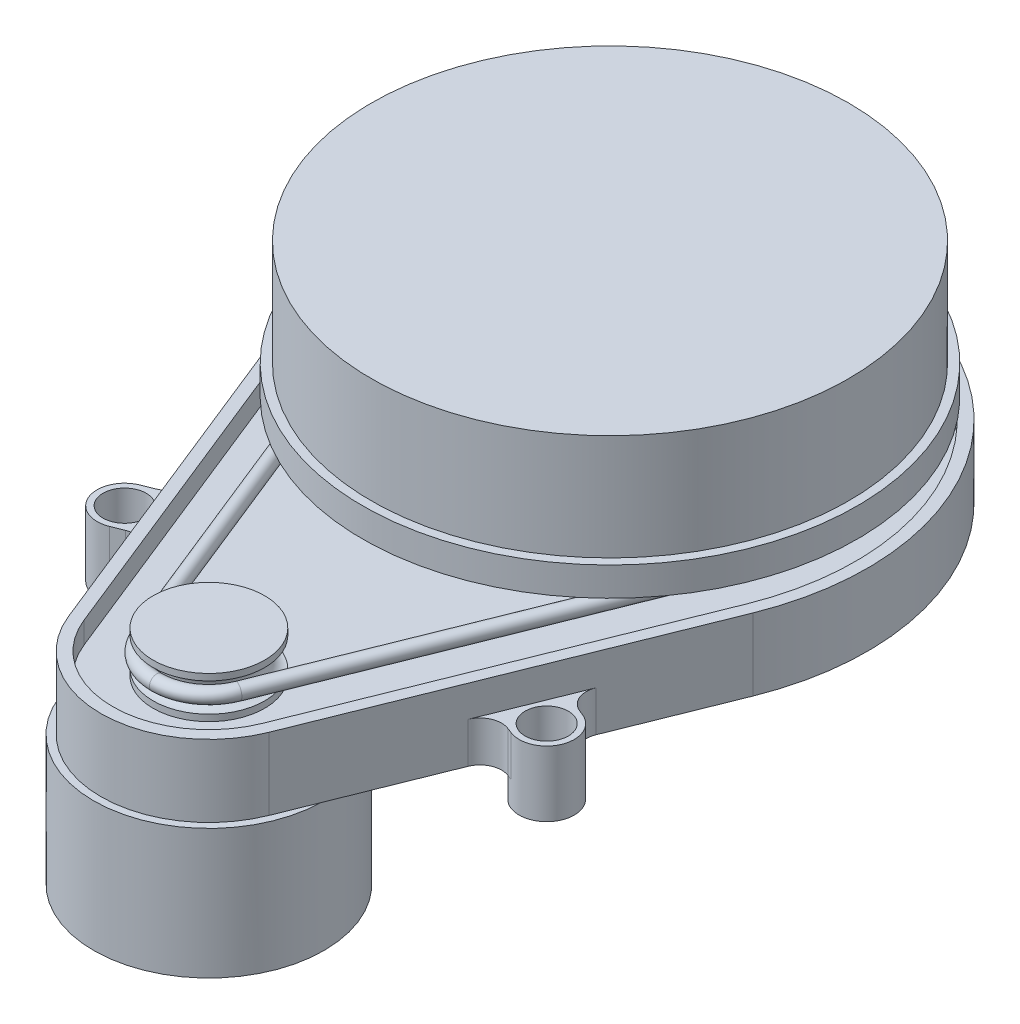
from build123d import *

# Parameters (mm, degrees)
EXTRUDE_1_DEPTH     = 10
CUT_EXTRUDE_1_DEPTH = 3
SKETCH_4_R          = 7.75
EXTRUDE_2_DEPTH     = 5.8
SKETCH_8_R          = 1
EXTRUDE_3_DEPTH     = 5.65
EXTRUDE_START       = 3.45
SKETCH_10_R         = 3.825
EXTRUDE_4_DEPTH     = 3.45
SKETCH_11_R         = 3
CUT_EXTRUDE_2_DEPTH = 4.85
SKETCH_12_R         = 1.7
CUT_EXTRUDE_3_DEPTH = 85.964948655
CUT_EXTRUDE_START   = -2
SKETCH_13_R         = 3
CUT_EXTRUDE_4_DEPTH = 2
SKETCH_14_R         = 16
EXTRUDE_5_DEPTH     = 18
SKETCH_15_R         = 3.75
EXTRUDE_6_DEPTH     = 3
SKETCH_16_R         = 5.25
CUT_EXTRUDE_5_DEPTH = 87.088341255
FILLET_1_R          = 3


with BuildPart() as part:
    # 草圖2 → 填料-伸長1 (new body)
    with BuildSketch(Plane(origin=(0, 0, 0), x_dir=(1, 0, 0), z_dir=(0, 1, 0))):
        with BuildLine():
            Line((-33.176700014, -13.317998205), (-13.920293712, -61.287971275))
            ThreePointArc((-13.920293712, -61.287971275), (0, -70.7), (13.920293712, -61.287971275))
            Line((13.920293712, -61.287971275), (33.176700014, -13.317998205))
            ThreePointArc((33.176700014, -13.317998205), (0, 35.75), (-33.176700014, -13.317998205))
        make_face()
    extrude(amount=EXTRUDE_1_DEPTH)

    # 草圖3 → 除料-伸長1 (cut)
    with BuildSketch(Plane(origin=(0, 10, 0), x_dir=(1, 0, 0), z_dir=(0, 1, 0))):
        with BuildLine():
            ThreePointArc((-12.389061404, -60.673294434), (0, -69.05), (12.389061404, -60.673294434))
            Line((12.389061404, -60.673294434), (31.645467706, -12.703321364))
            ThreePointArc((31.645467706, -12.703321364), (0, 34.1), (-31.645467706, -12.703321364))
            Line((-31.645467706, -12.703321364), (-12.389061404, -60.673294434))
        make_face()
    extrude(amount=-CUT_EXTRUDE_1_DEPTH, mode=Mode.SUBTRACT)

    # 草圖4 → 填料-伸長2 (add)
    with BuildSketch(Plane(origin=(0, 7, 0), x_dir=(1, 0, 0), z_dir=(0, 1, 0))):
        with Locations((0, -55.7)):
            Circle(SKETCH_4_R)
    extrude(amount=EXTRUDE_2_DEPTH)

    # 草圖5 → 除料-旋轉1 (revolve, cut)
    with BuildSketch(Plane(origin=(0, 0, 0), x_dir=(0, 0, -1), z_dir=(1, 0, 0))):
        with BuildLine():
            Line((-47.95, 11.9), (-47.95, 7.9))
            ThreePointArc((-47.95, 7.9), (-49.95, 9.9), (-47.95, 11.9))
        make_face()
    revolve(axis=Axis((0, 12.8, 55.7), (0, -1, 0)), mode=Mode.SUBTRACT)

    # 草圖6 → 旋轉1 (revolve)
    with BuildSketch(Plane(origin=(0, 0, 0), x_dir=(0, 0, -1), z_dir=(1, 0, 0))):
        Polygon((10, 12.8), (34.35, 12.8), (34.35, 16.8), (33.15, 16.8), (33.15, 31.5), (0, 31.5), (0, 7), (10, 7), align=None)
    revolve(axis=Axis((0, 7, 0), (0, 1, 0)))

    # 草圖9 → 填料-伸長3 (add)
    with BuildSketch(Plane(origin=(0, 0, 0), x_dir=(1, 0, 0), z_dir=(0, 1, 0))):
        with BuildLine():
            Line((29.234932675, -33.050325103), (25.807872874, -31.674613346))
            Line((25.807872874, -31.674613346), (22.958007523, -38.773963139))
            Line((22.958007523, -38.773963139), (26.385067325, -40.149674897))
            ThreePointArc((26.385067325, -40.149674897), (31.359674897, -38.024932675), (29.234932675, -33.050325103))
        make_face()
        with BuildLine():
            Line((-29.124932675, -36.150325103), (-24.720886114, -34.382425217))
            Line((-24.720886114, -34.382425217), (-21.871020764, -41.48177501))
            Line((-21.871020764, -41.48177501), (-26.275067325, -43.249674897))
            ThreePointArc((-26.275067325, -43.249674897), (-31.249674897, -41.124932675), (-29.124932675, -36.150325103))
        make_face()
        with BuildLine():
            Line((-9.225, 39.9), (-9.225, 34.539280175))
            ThreePointArc((-9.225, 34.539280175), (-5.431919481, 35.334922538), (-1.575, 35.715289093))
            Line((-1.575, 35.715289093), (-1.575, 39.9))
            ThreePointArc((-1.575, 39.9), (-5.4, 43.725), (-9.225, 39.9))
        make_face()
    extrude(amount=EXTRUDE_3_DEPTH)

    # 草圖10 → 填料-伸長4 (add)
    with BuildSketch(Plane.XZ.offset(EXTRUDE_START)):
        with Locations((27.81, 36.6)):
            Circle(SKETCH_10_R)
        with Locations((-5.4, -39.9)):
            Circle(SKETCH_10_R)
        with Locations((-27.7, 39.7)):
            Circle(SKETCH_10_R)
    extrude(amount=-EXTRUDE_4_DEPTH)

    # 草圖11 → 除料-伸長2 (cut)
    with BuildSketch(Plane(origin=(0, 5.65, 0), x_dir=(1, 0, 0), z_dir=(0, 1, 0))):
        with Locations((-5.4, 39.9)):
            Circle(SKETCH_11_R)
        with Locations((27.81, -36.6)):
            Circle(SKETCH_11_R)
        with Locations((-27.7, -39.7)):
            Circle(SKETCH_11_R)
    extrude(amount=-CUT_EXTRUDE_2_DEPTH, mode=Mode.SUBTRACT)

    # 草圖12 → 除料-伸長3 (cut, through all)
    with BuildSketch(Plane(origin=(0, 0.8, 0), x_dir=(1, 0, 0), z_dir=(0, 1, 0))):
        with Locations((27.81, -36.6)):
            Circle(SKETCH_12_R)
        with Locations((-27.7, -39.7)):
            Circle(SKETCH_12_R)
        with Locations((-5.4, 39.9)):
            Circle(SKETCH_12_R)
    extrude(amount=-CUT_EXTRUDE_3_DEPTH, mode=Mode.SUBTRACT)

    # 草圖13 → 除料-伸長4 (cut)
    with BuildSketch(Plane.XZ.offset(3.45).offset(CUT_EXTRUDE_START)):
        with Locations((-27.7, 39.7)):
            Circle(SKETCH_13_R)
        with Locations((27.81, 36.6)):
            Circle(SKETCH_13_R)
        with Locations((-5.4, -39.9)):
            Circle(SKETCH_13_R)
    extrude(amount=CUT_EXTRUDE_4_DEPTH, mode=Mode.SUBTRACT)

    # 草圖14 → 填料-伸長5 (add)
    with BuildSketch(Plane.XZ):
        with Locations((0, 55.7)):
            Circle(SKETCH_14_R)
    extrude(amount=EXTRUDE_5_DEPTH)

    # 草圖15 → 填料-伸長6 (add)
    with BuildSketch(Plane.XZ.offset(18)):
        with Locations((0, 55.7)):
            Circle(SKETCH_15_R)
    extrude(amount=EXTRUDE_6_DEPTH)

    # 草圖16 → 除料-伸長5 (cut, through all)
    with BuildSketch(Plane.XY):
        with Locations((15, 24.15)):
            Circle(SKETCH_16_R)
        with BuildLine():
            Line((-13.575, 18.9), (-19.575, 18.9))
            ThreePointArc((-19.575, 18.9), (-24.825, 24.15), (-19.575, 29.4))
            Line((-19.575, 29.4), (-13.575, 29.4))
            ThreePointArc((-13.575, 29.4), (-8.325, 24.15), (-13.575, 18.9))
        make_face()
    extrude(amount=-CUT_EXTRUDE_5_DEPTH, mode=Mode.SUBTRACT)

    # 圓角1
    fillet_1_edges = [part.edges().sort_by_distance(p)[0] for p in [
        (-1.575, 2.825, -35.715289093),
        (-9.225, 2.825, -34.539280175),
        (-24.720886114, 2.825, 34.382425217),
        (-21.871020764, 2.825, 41.48177501),
        (25.807872874, 2.825, 31.674613346),
        (22.958007523, 2.825, 38.773963139),
    ]]
    fillet(fillet_1_edges, radius=FILLET_1_R)


with BuildPart() as body_2:
    # 掃出1: sweep along a path in 草圖7
    with BuildLine(Plane(origin=(0, 9.9, 0), x_dir=(1, 0, 0), z_dir=(0, 1, 0))) as sweep_1_path:
        Line((25.520538472, -10.244614004), (6.26413217, -58.214587074))
        ThreePointArc((6.26413217, -58.214587074), (0, -62.45), (-6.26413217, -58.214587074))
        Line((-6.26413217, -58.214587074), (-25.520538472, -10.244614004))
        ThreePointArc((-25.520538472, -10.244614004), (0, 27.5), (25.520538472, -10.244614004))
    # 草圖8 → 掃出1 (sweep)
    with BuildSketch(Plane(origin=(0, 0, 0), x_dir=(0, 0, -1), z_dir=(1, 0, 0))):
        with Locations((-62.95, 9.9)):
            Circle(SKETCH_8_R)
    sweep(path=sweep_1_path.line)


solid = Compound([part.part, body_2.part])
